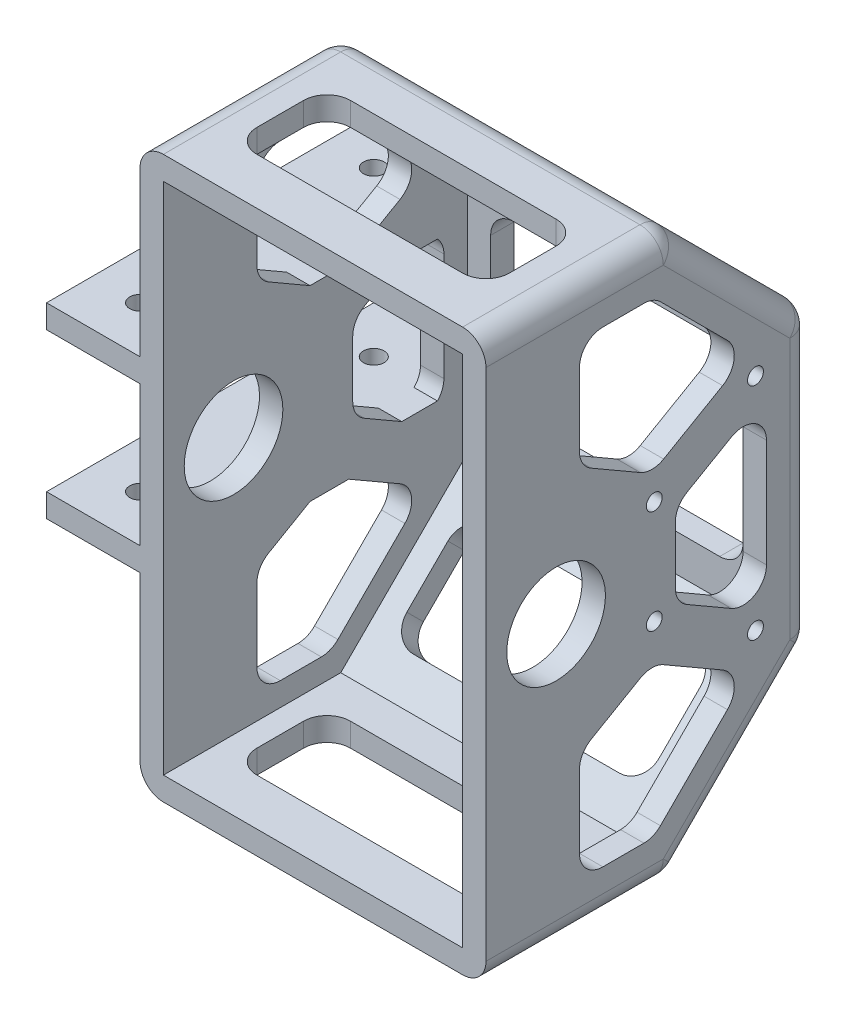
from build123d import *

# Parameters (mm, degrees)
SKETCH_1_W           = 74
SKETCH_1_H           = 120
EXTRUDE_1_DEPTH      = 70
CHAMFER_2_SIZE       = 30
SHELL_1_T            = -5
SKETCH_2_R           = 10.55
CUT_EXTRUDE_1_DEPTH  = 119.220133649
SKETCH_3_W           = 54
SKETCH_3_H           = 22.426406871
CUT_EXTRUDE_2_DEPTH  = 70
SKETCH_4_W           = 54
SKETCH_4_H           = 22.426406871
CUT_EXTRUDE_3_DEPTH  = 70
SKETCH_5_W           = 54
SKETCH_5_H           = 40
CUT_EXTRUDE_4_DEPTH  = 70
SKETCH_7_W           = 54
SKETCH_7_H           = 20
CUT_EXTRUDE_5_DEPTH  = 144.767172887
FILLET_1_R           = 5
EXTRUDE_3_DEPTH      = 20
EXTRUDE_3_DEPTH_BACK = 5
SKETCH_10_W          = 70
SKETCH_10_H          = 5
SKETCH_12_R          = 2.2
CUT_EXTRUDE_7_DEPTH  = 121.619235614
SKETCH_13_R          = 1.7
CUT_EXTRUDE_8_DEPTH  = 10


with BuildPart() as part:
    # ｽｹｯﾁ1 → ﾎﾞｽ - 押し出し1 (new body)
    with BuildSketch(Plane.XY):
        Rectangle(SKETCH_1_W, SKETCH_1_H)
    extrude(amount=EXTRUDE_1_DEPTH)

    # 面取り2
    chamfer_2_edges = [part.edges().sort_by_distance(p)[0] for p in [
        (0, 60, 0),
        (0, -60, 0),
    ]]
    chamfer(chamfer_2_edges, length=CHAMFER_2_SIZE)

    # ｼｪﾙ1
    shell_1_openings = [part.faces().sort_by_distance(p)[0] for p in [
        (0, 0, 70),
    ]]
    offset(amount=SHELL_1_T, openings=shell_1_openings, kind=Kind.INTERSECTION)

    # ｽｹｯﾁ2 → ｶｯﾄ - 押し出し1 (cut, through all)
    with BuildSketch(Plane.ZY.offset(37)):
        Polygon((34.142135624, -50), (50, -50), (50, -26.558112383), (34.5, -17.60918321), (13.738168081, -29.596032457), align=None)
        with Locations((55, 0)):
            Circle(SKETCH_2_R)
        Polygon((34.142135624, 50), (13.738168081, 29.596032457), (34.5, 17.60918321), (50, 26.558112383), (50, 50), align=None)
        Polygon((10, 20.207259422), (10, -20.207259422), (29.5, -8.948929172), (29.5, 8.948929172), align=None)
    extrude(amount=-CUT_EXTRUDE_1_DEPTH, mode=Mode.SUBTRACT)

    # ｽｹｯﾁ3 → ｶｯﾄ - 押し出し2 (cut)
    with BuildSketch(Plane(origin=(0, -15, -15), x_dir=(1, 0, 0), z_dir=(0, -0.7071067811865464, -0.7071067811865487))):
        with Locations((0, 42.426406872)):
            Rectangle(SKETCH_3_W, SKETCH_3_H)
    extrude(amount=-CUT_EXTRUDE_2_DEPTH, mode=Mode.SUBTRACT)

    # ｽｹｯﾁ4 → ｶｯﾄ - 押し出し3 (cut)
    with BuildSketch(Plane(origin=(0, 15, -15), x_dir=(1, 0, 0), z_dir=(0, 0.7071067811865464, -0.7071067811865487))):
        with Locations((0, -42.426406872)):
            Rectangle(SKETCH_4_W, SKETCH_4_H)
    extrude(amount=-CUT_EXTRUDE_3_DEPTH, mode=Mode.SUBTRACT)

    # ｽｹｯﾁ5 → ｶｯﾄ - 押し出し4 (cut)
    with BuildSketch(Plane(origin=(0, 0, 0), x_dir=(-1, 0, 0), z_dir=(0, 0, -1))):
        Rectangle(SKETCH_5_W, SKETCH_5_H)
    extrude(amount=-CUT_EXTRUDE_4_DEPTH, mode=Mode.SUBTRACT)

    # ｽｹｯﾁ7 → ｶｯﾄ - 押し出し5 (cut, through all)
    with BuildSketch(Plane(origin=(0, 60, 0), x_dir=(1, 0, 0), z_dir=(0, 1, 0))):
        with Locations((0, -50)):
            Rectangle(SKETCH_7_W, SKETCH_7_H)
    extrude(amount=-CUT_EXTRUDE_5_DEPTH, mode=Mode.SUBTRACT)

    # ﾌｨﾚｯﾄ1
    fillet_1_edges = [part.edges().sort_by_distance(p)[0] for p in [
        (27, 51.161165235, 24.696699141),
        (-27, 51.161165235, 24.696699141),
        (-27, 35.303300859, 8.838834765),
        (27, 35.303300859, 8.838834765),
        (-27, 20, 2.5),
        (-27, -20, 2.5),
        (27, 20, 2.5),
        (27, -20, 2.5),
        (-27, -35.303300859, 8.838834765),
        (-27, -51.161165235, 24.696699141),
        (27, -51.161165235, 24.696699141),
        (27, -35.303300859, 8.838834765),
        (34.5, -50, 34.142135624),
        (34.5, -29.596032457, 13.738168081),
        (34.5, -17.60918321, 34.5),
        (34.5, -26.558112383, 50),
        (34.5, -50, 50),
        (34.5, 26.558112383, 50),
        (34.5, 17.60918321, 34.5),
        (34.5, 29.596032457, 13.738168081),
        (34.5, 50, 34.142135624),
        (34.5, 50, 50),
        (34.5, -20.207259422, 10),
        (34.5, -8.948929172, 29.5),
        (34.5, 8.948929172, 29.5),
        (34.5, 20.207259422, 10),
        (-34.5, 29.596032457, 13.738168081),
        (-34.5, 50, 34.142135624),
        (-34.5, 50, 50),
        (-34.5, 26.558112383, 50),
        (-34.5, 17.60918321, 34.5),
        (-34.5, 20.207259422, 10),
        (-34.5, 8.948929172, 29.5),
        (-34.5, -20.207259422, 10),
        (-34.5, -8.948929172, 29.5),
        (-34.5, -29.596032457, 13.738168081),
        (-34.5, -17.60918321, 34.5),
        (-34.5, -26.558112383, 50),
        (-34.5, -50, 50),
        (-34.5, -50, 34.142135624),
        (-27, -57.5, 60),
        (-27, -57.5, 40),
        (27, -57.5, 40),
        (27, -57.5, 60),
        (27, 57.5, 60),
        (27, 57.5, 40),
        (-27, 57.5, 40),
        (-27, 57.5, 60),
        (37, -45, 15),
        (37, -60, 50),
        (-37, -60, 50),
        (-37, -45, 15),
        (0, -30, 0),
        (-37, 0, 0),
        (-37, 45, 15),
        (0, 60, 30),
        (-37, 60, 50),
        (37, 60, 50),
        (0, 30, 0),
        (37, 45, 15),
        (37, 0, 0),
        (0, -60, 30),
    ]]
    fillet(fillet_1_edges, radius=FILLET_1_R)

    # ｽｹｯﾁ10 → ﾎﾞｽ - 押し出し3 (add, two sides: drawn at the far end of the back side and taken through both)
    with BuildSketch(Plane.ZY.offset(37).offset(-EXTRUDE_3_DEPTH_BACK)):
        with Locations((35, 17.5)):
            Rectangle(SKETCH_10_W, SKETCH_10_H)
        with Locations((35, -17.5)):
            Rectangle(SKETCH_10_W, SKETCH_10_H)
    extrude(amount=EXTRUDE_3_DEPTH + EXTRUDE_3_DEPTH_BACK)

    # ｽｹｯﾁ12 → ｶｯﾄ - 押し出し7 (cut, through all)
    with BuildSketch(Plane.XZ.offset(20)):
        with Locations((-47, 60)):
            Circle(SKETCH_12_R)
        with Locations((-47, 10)):
            Circle(SKETCH_12_R)
    extrude(amount=-CUT_EXTRUDE_7_DEPTH, mode=Mode.SUBTRACT)

    # ｽｹｯﾁ13 → ｶｯﾄ - 押し出し8 (cut)
    with BuildSketch(Plane(origin=(37, 0, 0), x_dir=(0, 0, -1), z_dir=(1, 0, 0))):
        with Locations((-12.349364905, 24.624355653)):
            Circle(SKETCH_13_R)
        with Locations((-34, 12.124355653)):
            Circle(SKETCH_13_R)
        with Locations((-34, -10.011106999)):
            Circle(SKETCH_13_R)
        with Locations((-12.349364905, -22.511106999)):
            Circle(SKETCH_13_R)
    extrude(amount=-CUT_EXTRUDE_8_DEPTH, mode=Mode.SUBTRACT)


solid = part.part
